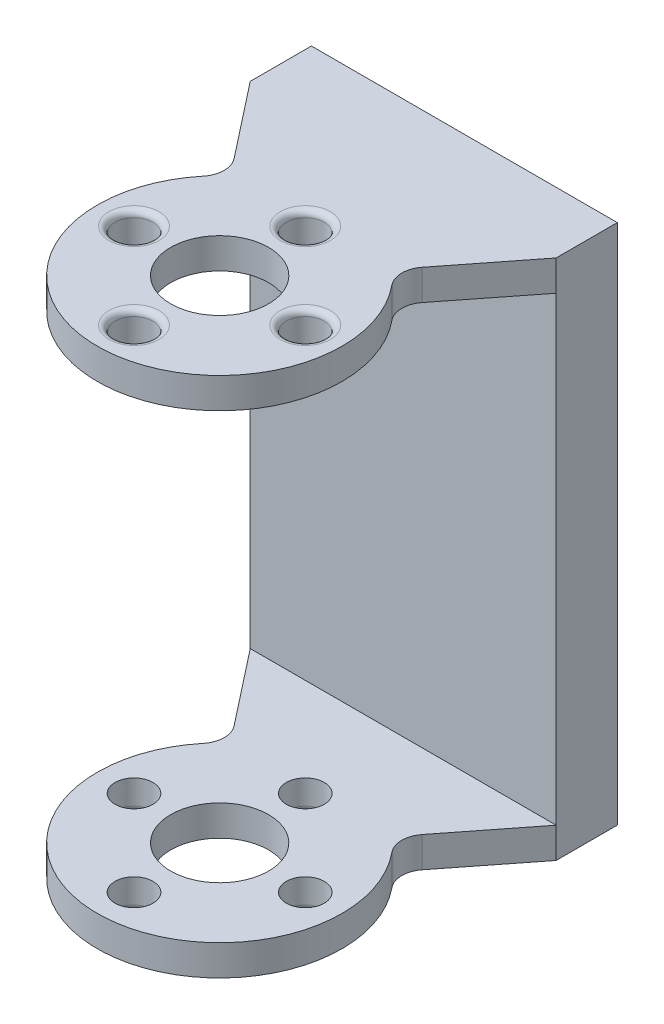
from build123d import *

# Parameters (mm, degrees)
SKETCH1_R           = 4
BOSS_EXTRUDE1_DEPTH = 42.65
SKETCH2_W           = 40
SKETCH2_H           = 37.65
CUT_EXTRUDE1_DEPTH  = 54.329377457
SKETCH3_R           = 1.55
CUT_EXTRUDE2_DEPTH  = 49.736767435
CIRPATTERN1_COUNT   = 4
FILLET1_R           = 2
FILLET2_R           = 0.5


with BuildPart() as part:
    # Sketch1 → Boss-Extrude1 (new body)
    with BuildSketch(Plane(origin=(0, 0, 0), x_dir=(1, 0, 0), z_dir=(0, 1, 0))):
        with BuildLine():
            Line((-12.5, 15), (-12.5, 20))
            Line((-12.5, 20), (12.5, 20))
            Line((12.5, 20), (12.5, 15))
            Line((12.5, 15), (6.614378278, 7.5))
            ThreePointArc((6.614378278, 7.5), (0, -10), (-6.614378278, 7.5))
            Line((-6.614378278, 7.5), (-12.5, 15))
        make_face()
        Circle(SKETCH1_R, mode=Mode.SUBTRACT)
    extrude(amount=BOSS_EXTRUDE1_DEPTH)

    # Sketch2 → Cut-Extrude1 (cut, through all)
    with BuildSketch(Plane.ZY.offset(12.5)):
        with Locations((5, 21.325)):
            Rectangle(SKETCH2_W, SKETCH2_H)
    extrude(amount=-CUT_EXTRUDE1_DEPTH, mode=Mode.SUBTRACT)

    # Sketch3 → Cut-Extrude2 (cut, through all)
    with BuildSketch(Plane(origin=(0, 42.65, 0), x_dir=(1, 0, 0), z_dir=(0, 1, 0))):
        with Locations((0, 7)):
            Circle(SKETCH3_R)
    cut_extrude2 = extrude(amount=-CUT_EXTRUDE2_DEPTH, mode=Mode.SUBTRACT)

    # CirPattern1: Cut-Extrude2 ×4 about axis
    cirpattern1_axis = Axis((0, 42.65, 0), (0, -1, 0))
    for i in range(1, CIRPATTERN1_COUNT):
        add(cut_extrude2.rotate(cirpattern1_axis, i * 360 / CIRPATTERN1_COUNT), mode=Mode.SUBTRACT)

    # Fillet1
    fillet1_edges = [part.edges().sort_by_distance(p)[0] for p in [
        (6.614378278, 41.4, -7.5),
        (6.614378278, 1.25, -7.5),
        (-6.614378278, 41.4, -7.5),
        (-6.614378278, 1.25, -7.5),
    ]]
    fillet(fillet1_edges, radius=FILLET1_R)

    # Fillet2
    fillet2_edges = [part.edges().sort_by_distance(p)[0] for p in [
        (7, 0, -1.55),
        (1.55, 0, 7),
        (-7, 0, 1.55),
        (-1.55, 0, -7),
        (-7, 42.65, 1.55),
        (1.55, 42.65, 7),
        (7, 42.65, -1.55),
        (-1.55, 42.65, -7),
    ]]
    fillet(fillet2_edges, radius=FILLET2_R)


solid = part.part
